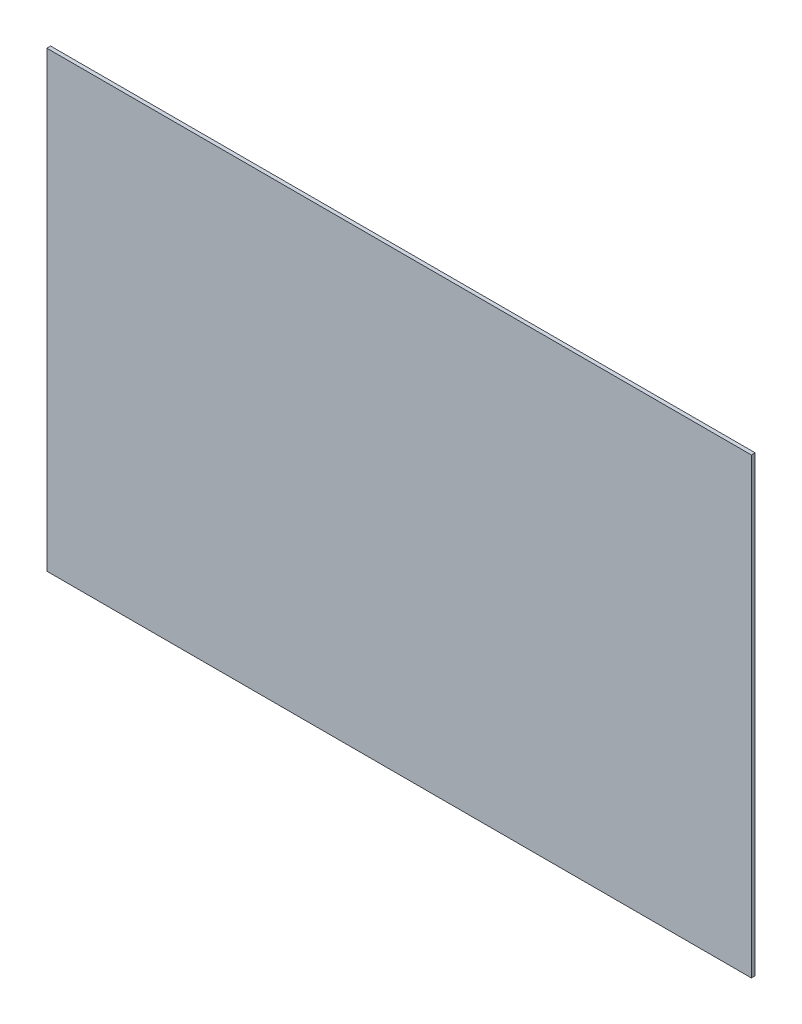
from build123d import *

# Parameters (mm, degrees)
SKETCH1_W          = 280
SKETCH1_H          = 1.5
BASE_FLANGE1_DEPTH = 180


# Sheet-metal steps are written as plain solids
with BuildPart() as part:
    # Sketch1 → Base-Flange1 (new body)
    with BuildSketch(Plane(origin=(0, 0, 0), x_dir=(1, 0, 0), z_dir=(0, 1, 0))):
        with Locations((140, -0.75)):
            Rectangle(SKETCH1_W, SKETCH1_H)
    extrude(amount=BASE_FLANGE1_DEPTH)


solid = part.part
